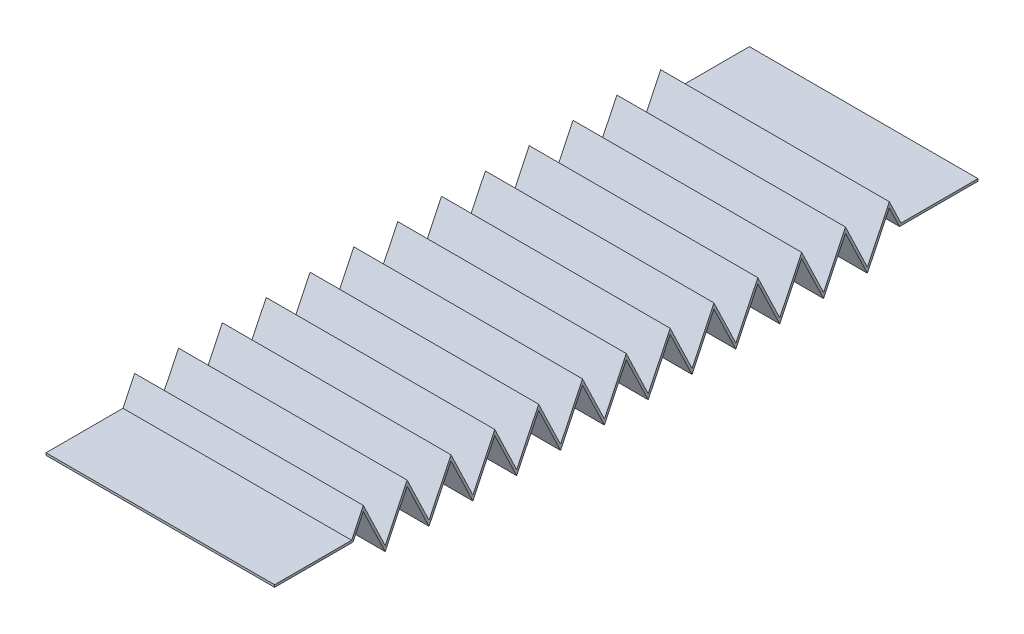
from build123d import *

# Parameters (mm, degrees)
EXTRUDE_THIN1_DEPTH = 25


with BuildPart() as part:
    # Sketch3 → Extrude-Thin1 (new, symmetric)
    with BuildSketch(Plane(origin=(0, 0, 0), x_dir=(0, 0, -1), z_dir=(1, 0, 0))):
        Polygon((0, 4.75), (17.157398019, 4.75), (19.396844886, 9.421655809), (24.190534658, -0.578344191), (28.98422443, 9.421655809), (33.777914202, -0.578344191), (38.571603974, 9.421655809), (43.365293746, -0.578344191), (48.158983518, 9.421655809), (52.95267329, -0.578344191), (57.746363061, 9.421655809), (62.540052833, -0.578344191), (67.333742605, 9.421655809), (72.127432377, -0.578344191), (76.921122149, 9.421655809), (81.714811921, -0.578344191), (86.508501693, 9.421655809), (91.302191465, -0.578344191), (96.095881237, 9.421655809), (100.889571009, -0.578344191), (105.683260781, 9.421655809), (110.476950553, -0.578344191), (115.270640325, 9.421655809), (120.064330097, -0.578344191), (124.858019869, 9.421655809), (129.651709641, -0.578344191), (134.445399413, 9.421655809), (136.68484628, 4.75), (153.842244298, 4.75), (153.842244298, 5.25), (136.999642317, 5.25), (134.445399413, 10.578344191), (129.651709641, 0.578344191), (124.858019869, 10.578344191), (120.064330097, 0.578344191), (115.270640325, 10.578344191), (110.476950553, 0.578344191), (105.683260781, 10.578344191), (100.889571009, 0.578344191), (96.095881237, 10.578344191), (91.302191465, 0.578344191), (86.508501693, 10.578344191), (81.714811921, 0.578344191), (76.921122149, 10.578344191), (72.127432377, 0.578344191), (67.333742605, 10.578344191), (62.540052833, 0.578344191), (57.746363061, 10.578344191), (52.95267329, 0.578344191), (48.158983518, 10.578344191), (43.365293746, 0.578344191), (38.571603974, 10.578344191), (33.777914202, 0.578344191), (28.98422443, 10.578344191), (24.190534658, 0.578344191), (19.396844886, 10.578344191), (16.842601981, 5.25), (0, 5.25), align=None)
    extrude(amount=EXTRUDE_THIN1_DEPTH, both=True)


solid = part.part
